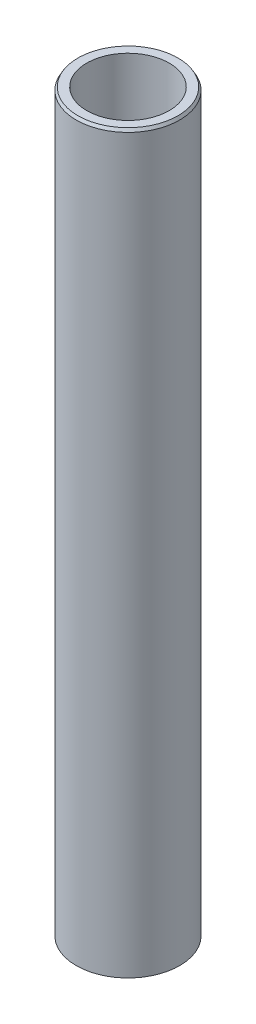
from build123d import *
from OCP.BRepFilletAPI import BRepFilletAPI_MakeChamfer

# Parameters (mm, degrees)
SKETCH1_R           = 20
BOSS_EXTRUDE1_DEPTH = 284.977533599
SKETCH2_R           = 15.946316339
CUT_EXTRUDE1_DEPTH  = 287.377713267
CHAMFER1_SIZE       = 1.125801684
CHAMFER1_SIZE2      = 0.649981905


with BuildPart() as part:
    # Sketch1 → Boss-Extrude1 (new body)
    with BuildSketch(Plane(origin=(0, 0, 0), x_dir=(1, 0, 0), z_dir=(0, 1, 0))):
        Circle(SKETCH1_R)
    extrude(amount=BOSS_EXTRUDE1_DEPTH)

    # Sketch2 → Cut-Extrude1 (cut, through all)
    with BuildSketch(Plane(origin=(0, 0, 0), x_dir=(1, 0, 0), z_dir=(0, 1, 0))):
        Circle(SKETCH2_R)
    extrude(amount=CUT_EXTRUDE1_DEPTH, mode=Mode.SUBTRACT)

    # Chamfer1: one chamfer whose edges measure the first distance from different faces: ONE call of the kernel's chamfer builder (chamfer() names one face for all edges)
    chamfer1_edges_1 = [part.edges().sort_by_distance(p)[0] for p in [
        (-20, 284.977533599, 0),
    ]]
    chamfer1_side_1 = [part.faces().sort_by_distance(p)[0] for p in [
        (-20, 142.4887668, 0),
    ]]
    chamfer1_edges_2 = [part.edges().sort_by_distance(p)[0] for p in [
        (-20, 0, 0),
    ]]
    chamfer1_side_2 = [part.faces().sort_by_distance(p)[0] for p in [
        (-19.434314575, 0, 0),
    ]]
    chamfer1 = BRepFilletAPI_MakeChamfer(part.part.solid().wrapped)
    for e in chamfer1_edges_1:
        chamfer1.Add(CHAMFER1_SIZE, CHAMFER1_SIZE2, e.wrapped, chamfer1_side_1[0].wrapped)  # the first distance lies on this face
    for e in chamfer1_edges_2:
        chamfer1.Add(CHAMFER1_SIZE, CHAMFER1_SIZE2, e.wrapped, chamfer1_side_2[0].wrapped)  # the first distance lies on this face
    add(Compound.cast(chamfer1.Shape()), mode=Mode.REPLACE)


solid = part.part
